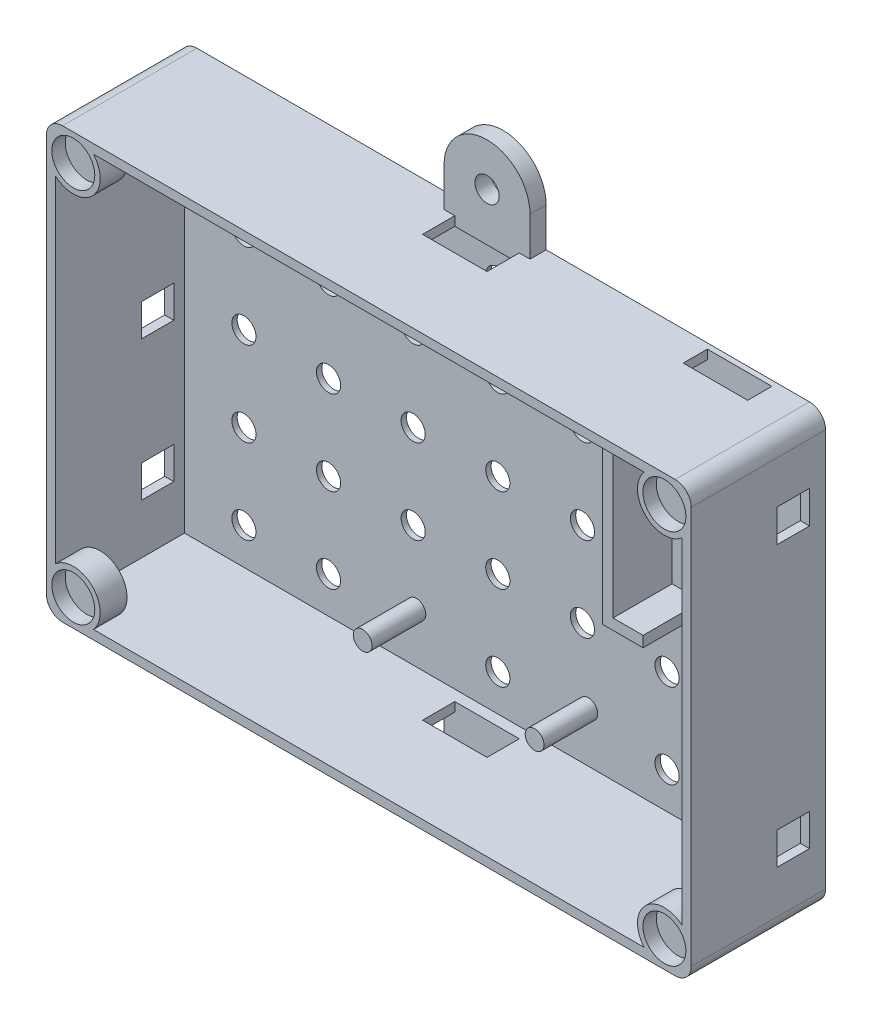
from build123d import *

# Parameters (mm, degrees)
SKETCH1_W               = 120
SKETCH1_H               = 80
BOSS_EXTRUDE1_DEPTH     = 25
SKETCH2_W               = 116.6
SKETCH2_H               = 76.6
CUT_EXTRUDE1_DEPTH      = 24
SKETCH4_R               = 2.25
BOSS_EXTRUDE3_DEPTH     = 3
SKETCH6_W               = 5.06
SKETCH6_H               = 2
BOSS_EXTRUDE4_DEPTH     = 12
SKETCH7_R               = 1.75
BOSS_EXTRUDE5_DEPTH     = 10
SKETCH8_R               = 5
BOSS_EXTRUDE6_DEPTH     = 5
SKETCH9_R               = 4
CUT_EXTRUDE2_DEPTH      = 2.5
MIRROR2_COPY_1_SKETCH_R = 5
MIRROR2_COPY_1_DEPTH    = 5
MIRROR2_COPY_2_SKETCH_R = 4
MIRROR2_COPY_2_DEPTH    = 2.5
FILLET1_R               = 3
SKETCH10_R              = 2.25
CUT_EXTRUDE3_DEPTH      = 2
CUT_EXTRUDE4_REACH      = 157.234
SKETCH11_W              = 12
SKETCH11_H              = 4.5
CUT_EXTRUDE5_DEPTH      = 156.233896105
CUT_EXTRUDE5_DEPTH_BACK = 156.233896105
CUT_EXTRUDE6_START      = -1.7
CUT_EXTRUDE6_DEPTH      = 157.933896105
MIRROR3_START           = 3
MIRROR3_OUTLINE_W       = 1.7
MIRROR3_OUTLINE_H       = 6.070107007
MIRROR3_OUTLINE_H_2     = 6
MIRROR3_DEPTH           = 6


# Read off the part's stored shape, not the designer's step: Mirror3
with BuildPart() as part:
    # Sketch1 → Boss-Extrude1 (new body)
    with BuildSketch(Plane.XY):
        with Locations((60, 40)):
            Rectangle(SKETCH1_W, SKETCH1_H)
    extrude(amount=BOSS_EXTRUDE1_DEPTH)

    # Sketch2 → Cut-Extrude1 (cut)
    with BuildSketch(Plane.XY.offset(25)):
        with Locations((60, 40)):
            Rectangle(SKETCH2_W, SKETCH2_H)
    extrude(amount=-CUT_EXTRUDE1_DEPTH, mode=Mode.SUBTRACT)

    # Sketch4 → Boss-Extrude3 (add)
    # profile 1 of 2: a face of its own
    with BuildSketch(Plane(origin=(0, 0, 0), x_dir=(-1, 0, 0), z_dir=(0, 0, -1))):
        with BuildLine():
            Line((-68, 80), (-68, 87.25))
            ThreePointArc((-68, 87.25), (-60, 95.25), (-52, 87.25))
            Line((-52, 87.25), (-52, 80))
            Line((-52, 80), (-68, 80))
        make_face()
        with Locations((-60, 87.25)):
            Circle(SKETCH4_R, mode=Mode.SUBTRACT)
    # profile 2 of 2: a face of its own
    with BuildSketch(Plane(origin=(0, 0, 0), x_dir=(-1, 0, 0), z_dir=(0, 0, -1))):
        with BuildLine():
            Line((-68, 0), (-68, -7.25))
            ThreePointArc((-68, -7.25), (-60, -15.25), (-52, -7.25))
            Line((-52, -7.25), (-52, 0))
            Line((-52, 0), (-68, 0))
        make_face()
        with Locations(Location((-60, -7.25, 0), (0, 0, 180))):
            Circle(SKETCH4_R, mode=Mode.SUBTRACT)
    extrude(amount=-BOSS_EXTRUDE3_DEPTH)

    # Sketch6 → Boss-Extrude4 (add)
    with BuildSketch(Plane.XY):
        Polygon((90.44, 78.3), (92.44, 78.3), (92.44, 38.89), (98.04, 38.89), (98.04, 36.89), (90.44, 36.89), align=None)
        with Locations((115.77, 37.89)):
            Rectangle(SKETCH6_W, SKETCH6_H)
    extrude(amount=BOSS_EXTRUDE4_DEPTH)

    # Sketch7 → Boss-Extrude5 (add)
    with BuildSketch(Plane.XY.offset(1)):
        with Locations((44.85, 69)):
            Circle(SKETCH7_R)
        with Locations((44.85, 11)):
            Circle(SKETCH7_R)
        with Locations((76.85, 69)):
            Circle(SKETCH7_R)
        with Locations((76.85, 11)):
            Circle(SKETCH7_R)
    extrude(amount=BOSS_EXTRUDE5_DEPTH)

    # Sketch8 → Boss-Extrude6 (add)
    with BuildSketch(Plane.XY.offset(25)):
        with Locations((5, 75)):
            Circle(SKETCH8_R)
    boss_extrude6 = extrude(amount=-BOSS_EXTRUDE6_DEPTH)

    # Sketch9 → Cut-Extrude2 (cut)
    with BuildSketch(Plane.XY.offset(25)):
        with Locations((5, 75)):
            Circle(SKETCH9_R)
    cut_extrude2 = extrude(amount=-CUT_EXTRUDE2_DEPTH, mode=Mode.SUBTRACT)

    # Mirror1: Boss-Extrude6, Cut-Extrude2 across plane
    add(boss_extrude6.mirror(Plane.ZY.offset(-60)))
    add(cut_extrude2.mirror(Plane.ZY.offset(-60)), mode=Mode.SUBTRACT)

    # Mirror2: Boss-Extrude6, Cut-Extrude2 across plane
    add(boss_extrude6.mirror(Plane.ZX.offset(40)))
    add(cut_extrude2.mirror(Plane.ZX.offset(40)), mode=Mode.SUBTRACT)

    # Mirror2 copy 1 sketch → Mirror2 copy 1 (add)
    with BuildSketch(Plane(origin=(120, 80, 25), x_dir=(-1, 0, 0), z_dir=(0, 0, 1))):
        with Locations((5, 75)):
            Circle(MIRROR2_COPY_1_SKETCH_R)
    extrude(amount=-MIRROR2_COPY_1_DEPTH)

    # Mirror2 copy 2 sketch → Mirror2 copy 2 (cut)
    with BuildSketch(Plane(origin=(120, 80, 25), x_dir=(-1, 0, 0), z_dir=(0, 0, 1))):
        with Locations((5, 75)):
            Circle(MIRROR2_COPY_2_SKETCH_R)
    extrude(amount=-MIRROR2_COPY_2_DEPTH, mode=Mode.SUBTRACT)

    # Fillet1
    fillet1_edges = [part.edges().sort_by_distance(p)[0] for p in [
        (0, 80, 12.5),
        (120, 80, 12.5),
        (120, 0, 12.5),
        (0, 0, 12.5),
    ]]
    fillet(fillet1_edges, radius=FILLET1_R)

    # Sketch10 → Cut-Extrude3 (cut)
    with BuildSketch(Plane(origin=(0, 0, 0), x_dir=(-1, 0, 0), z_dir=(0, 0, -1))):
        with Locations((-28.5, 71.5)):
            Circle(SKETCH10_R)
        with Locations((-12.75, 55.75)):
            Circle(SKETCH10_R)
        with Locations((-28.5, 55.75)):
            Circle(SKETCH10_R)
        with Locations((-12.75, 40)):
            Circle(SKETCH10_R)
        with Locations((-28.5, 40)):
            Circle(SKETCH10_R)
        with Locations((-44.25, 40)):
            Circle(SKETCH10_R)
        with Locations((-12.75, 24.25)):
            Circle(SKETCH10_R)
        with Locations((-28.5, 24.25)):
            Circle(SKETCH10_R)
        with Locations((-44.25, 24.25)):
            Circle(SKETCH10_R)
        with Locations((-12.75, 8.5)):
            Circle(SKETCH10_R)
        with BuildLine():
            ThreePointArc((-57.75, 24.25), (-58.409009742, 25.840990258), (-60, 26.5))
            Line((-60, 26.5), (-60, 22))
            ThreePointArc((-60, 22), (-58.409009742, 22.659009742), (-57.75, 24.25))
        make_face()
        with BuildLine():
            Line((-60, 22), (-60, 26.5))
            ThreePointArc((-60, 26.5), (-62.25, 24.25), (-60, 22))
        make_face()
        with BuildLine():
            ThreePointArc((-57.75, 8.5), (-58.409009742, 10.090990258), (-60, 10.75))
            Line((-60, 10.75), (-60, 6.25))
            ThreePointArc((-60, 6.25), (-58.409009742, 6.909009742), (-57.75, 8.5))
        make_face()
        with BuildLine():
            Line((-60, 6.25), (-60, 10.75))
            ThreePointArc((-60, 10.75), (-62.25, 8.5), (-60, 6.25))
        make_face()
        with BuildLine():
            ThreePointArc((-57.75, 40), (-58.409009742, 41.590990258), (-60, 42.25))
            Line((-60, 42.25), (-60, 37.75))
            ThreePointArc((-60, 37.75), (-58.409009742, 38.409009742), (-57.75, 40))
        make_face()
        with BuildLine():
            Line((-60, 37.75), (-60, 42.25))
            ThreePointArc((-60, 42.25), (-62.25, 40), (-60, 37.75))
        make_face()
        with BuildLine():
            ThreePointArc((-57.75, 55.75), (-58.409009742, 57.340990258), (-60, 58))
            Line((-60, 58), (-60, 53.5))
            ThreePointArc((-60, 53.5), (-58.409009742, 54.159009742), (-57.75, 55.75))
        make_face()
        with BuildLine():
            Line((-60, 53.5), (-60, 58))
            ThreePointArc((-60, 58), (-62.25, 55.75), (-60, 53.5))
        make_face()
        with BuildLine():
            ThreePointArc((-57.75, 71.5), (-58.409009742, 73.090990258), (-60, 73.75))
            Line((-60, 73.75), (-60, 69.25))
            ThreePointArc((-60, 69.25), (-58.409009742, 69.909009742), (-57.75, 71.5))
        make_face()
        with BuildLine():
            Line((-60, 69.25), (-60, 73.75))
            ThreePointArc((-60, 73.75), (-62.25, 71.5), (-60, 69.25))
        make_face()
        with Locations((-75.75, 24.25)):
            Circle(SKETCH10_R)
        with Locations((-75.75, 55.75)):
            Circle(SKETCH10_R)
        with Locations((-75.75, 40)):
            Circle(SKETCH10_R)
        with Locations((-91.5, 24.25)):
            Circle(SKETCH10_R)
        with Locations((-107.25, 24.25)):
            Circle(SKETCH10_R)
        with Locations((-107.25, 8.5)):
            Circle(SKETCH10_R)
        with Locations((-107.25, 55.75)):
            Circle(SKETCH10_R)
        with Locations((-107.25, 40)):
            Circle(SKETCH10_R)
        with Locations((-12.75, 71.5)):
            Circle(SKETCH10_R)
        with Locations((-44.25, 55.75)):
            Circle(SKETCH10_R)
        with Locations((-28.5, 8.5)):
            Circle(SKETCH10_R)
        with Locations((-60, 8.5)):
            Circle(SKETCH10_R)
        with Locations((-91.5, 8.5)):
            Circle(SKETCH10_R)
        with Locations((-107.25, 71.5)):
            Circle(SKETCH10_R)
    extrude(amount=-CUT_EXTRUDE3_DEPTH, mode=Mode.SUBTRACT)

    # Sketch11 → Cut-Extrude4 (cut, up to next)
    with BuildSketch(Plane(origin=(0, 80, 0), x_dir=(1, 0, 0), z_dir=(0, 1, 0)), mode=Mode.PRIVATE) as cut_extrude4_sk1:
        with Locations((105, -3.25)):
            Rectangle(SKETCH11_W, SKETCH11_H)
    cut_extrude4_tool1 = extrude(cut_extrude4_sk1.sketch, amount=-CUT_EXTRUDE4_REACH, mode=Mode.PRIVATE) & part.part
    add(cut_extrude4_tool1.solids().sort_by_distance((105, 80, 3.25))[0], mode=Mode.SUBTRACT)

    # Sketch12 → Cut-Extrude5 (cut, two sides: drawn at the far end of the back side and taken through both)
    with BuildSketch(Plane.XZ.offset(-CUT_EXTRUDE5_DEPTH_BACK)):
        Polygon((60, 3), (54, 3), (54, 9), (60, 9), (66, 9), (66, 3), align=None)
    extrude(amount=CUT_EXTRUDE5_DEPTH + CUT_EXTRUDE5_DEPTH_BACK, mode=Mode.SUBTRACT)

    # Sketch13 → Cut-Extrude6 (cut)
    with BuildSketch(Plane.ZY.offset(CUT_EXTRUDE6_START)):
        Polygon((3, 40), (3, 43), (9, 43), (9, 40), (9, 37), (3, 37), align=None)
        Polygon((3, 65), (3, 69.070107007), (9, 69.070107007), (9, 66), (9, 63), (3, 63), align=None)
        Polygon((3, 17), (3, 11), (9, 11), (9, 15.086809652), (9, 17), align=None)
    extrude(amount=CUT_EXTRUDE6_DEPTH, mode=Mode.SUBTRACT)

    # Mirror3 outline → Mirror3 (cut)
    with BuildSketch(Plane.XY.offset(MIRROR3_START)):
        with Locations((119.15, 66.035053504)):
            Rectangle(MIRROR3_OUTLINE_W, MIRROR3_OUTLINE_H)
        with Locations((119.15, 14)):
            Rectangle(MIRROR3_OUTLINE_W, MIRROR3_OUTLINE_H_2)
    extrude(amount=MIRROR3_DEPTH, mode=Mode.SUBTRACT)


solid = part.part
